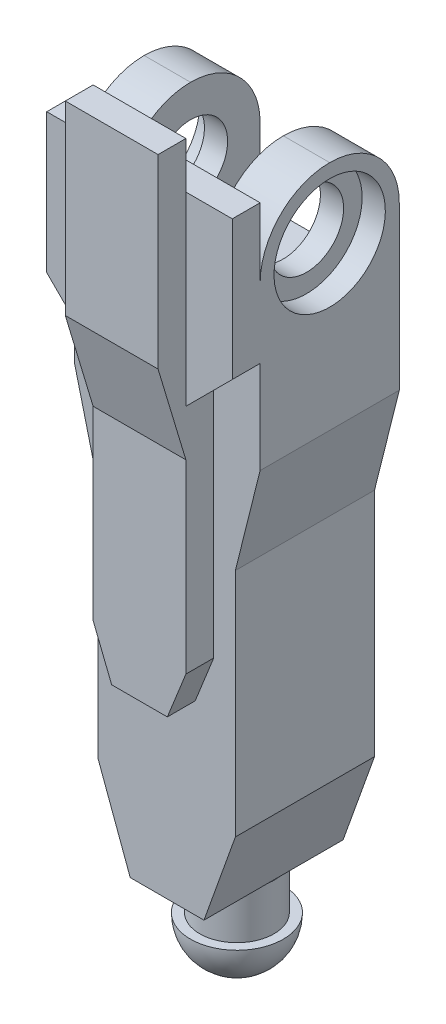
from build123d import *

# Parameters (mm, degrees)
BOSS_EXTRUDE2_DEPTH = 15
SKETCH2_R           = 4
CUT_EXTRUDE1_DEPTH  = 20
SKETCH3_R           = 6
CUT_EXTRUDE2_DEPTH  = 2.5
CUT_EXTRUDE3_START  = -2.5
SKETCH4_R           = 6
CUT_EXTRUDE3_DEPTH  = 2.5
FILLET1_R           = 7.5
BOSS_EXTRUDE3_DEPTH = 3
SKETCH6_W           = 10
SKETCH6_H           = 30
BOSS_EXTRUDE4_DEPTH = 3
CUT_EXTRUDE4_DEPTH  = 10
SKETCH8_R           = 4
BOSS_EXTRUDE6_DEPTH = 5
REVOLVE3_ANGLE      = 180
CUT_EXTRUDE6_DEPTH  = 15


with BuildPart() as part:
    # Sketch1 → Boss-Extrude2 (new body)
    with BuildSketch(Plane.XY):
        Polygon((4.00158439, 29.571674002), (4.00158439, 14.571674002), (-5.99841561, 14.571674002), (-5.99841561, 29.571674002), (-10.99841561, 29.571674002), (-10.99841561, -40.428325998), (9.00158439, -40.428325998), (9.00158439, 29.571674002), align=None)
    extrude(amount=BOSS_EXTRUDE2_DEPTH)

    # Sketch2 → Cut-Extrude1 (cut)
    with BuildSketch(Plane.ZY.offset(10.99841561)):
        with Locations((7.5, 22.071674002)):
            Circle(SKETCH2_R)
    extrude(amount=-CUT_EXTRUDE1_DEPTH, mode=Mode.SUBTRACT)

    # Sketch3 → Cut-Extrude2 (cut)
    with BuildSketch(Plane.ZY.offset(10.99841561)):
        with Locations((7.5, 22.071674002)):
            Circle(SKETCH3_R)
    extrude(amount=-CUT_EXTRUDE2_DEPTH, mode=Mode.SUBTRACT)

    # Sketch4 → Cut-Extrude3 (cut)
    with BuildSketch(Plane(origin=(9.00158439, 0, 0), x_dir=(0, 0, -1), z_dir=(1, 0, 0)).offset(CUT_EXTRUDE3_START)):
        with Locations(Location((-7.5, 22.071674002, 0), (0, 0, 180))):
            Circle(SKETCH4_R)
    extrude(amount=CUT_EXTRUDE3_DEPTH, mode=Mode.SUBTRACT)

    # Fillet1
    fillet1_edges = [part.edges().sort_by_distance(p)[0] for p in [
        (6.50158439, 29.571674002, 0),
        (6.50158439, 29.571674002, 15),
        (-8.49841561, 29.571674002, 0),
        (-8.49841561, 29.571674002, 15),
    ]]
    fillet(fillet1_edges, radius=FILLET1_R - 0.0001)  # a hair under: the kernel refuses the full size

    # Sketch5 → Boss-Extrude3 (add)
    with BuildSketch(Plane.XY.offset(15)):
        Polygon((-5.99841561, 9.571674002), (-5.99841561, -15.428325998), (-3.99841561, -20.428325998), (2.00158439, -20.428325998), (4.00158439, -15.428325998), (4.00158439, 9.571674002), (9.00158439, 14.571674002), (9.00158439, 29.571674002), (-10.99841561, 29.571674002), (-10.99841561, 14.548804666), align=None)
    extrude(amount=BOSS_EXTRUDE3_DEPTH)

    # Sketch6 → Boss-Extrude4 (add)
    with BuildSketch(Plane.XY.offset(18)):
        with Locations((-0.99841561, 19.571674002)):
            Rectangle(SKETCH6_W, SKETCH6_H)
    extrude(amount=BOSS_EXTRUDE4_DEPTH)

    # Sketch7 → Cut-Extrude4 (cut)
    with BuildSketch(Plane.ZY.offset(5.99841561)):
        Polygon((21, 14.548804666), (18, 4.571674002), (21, 4.571674002), align=None)
    extrude(amount=-CUT_EXTRUDE4_DEPTH, mode=Mode.SUBTRACT)

    # Sketch8 → Boss-Extrude6 (add)
    with BuildSketch(Plane.XZ.offset(40.428325998)):
        with Locations(Location((-0.99841561, 7.5, 0), (0, 0, 270))):
            Circle(SKETCH8_R)
    extrude(amount=BOSS_EXTRUDE6_DEPTH)

    # Sketch9 → Revolve3 (revolve)
    with BuildSketch(Plane(origin=(0, -45.428325998, 0), x_dir=(-1, 0, 0), z_dir=(0, -1, 0))):
        with BuildLine():
            Line((0.99841561, -12.5), (0.99841561, -2.5))
            ThreePointArc((0.99841561, -2.5), (5.99841561, -7.5), (0.99841561, -12.5))
        make_face()
    revolve(axis=Axis((-0.99841561, -45.428325998, 12.5), (0, 0, 1)), revolution_arc=REVOLVE3_ANGLE)

    # Sketch10 → Cut-Extrude6 (cut)
    with BuildSketch(Plane.XY.offset(15)):
        Polygon((6.335572216, -30.967221552), (2.949498735, -40.428325998), (9.00158439, -40.428325998), (9.00158439, 4.571674002), (6.335572216, -6.092374694), align=None)
        Polygon((-8.49841561, -24.415311945), (-8.49841561, -5.428325998), (-10.99841561, 4.571674002), (-10.99841561, -40.428325998), (-4.99841561, -40.428325998), (-8.49841561, -30.967221552), align=None)
    extrude(amount=-CUT_EXTRUDE6_DEPTH, mode=Mode.SUBTRACT)


solid = part.part
